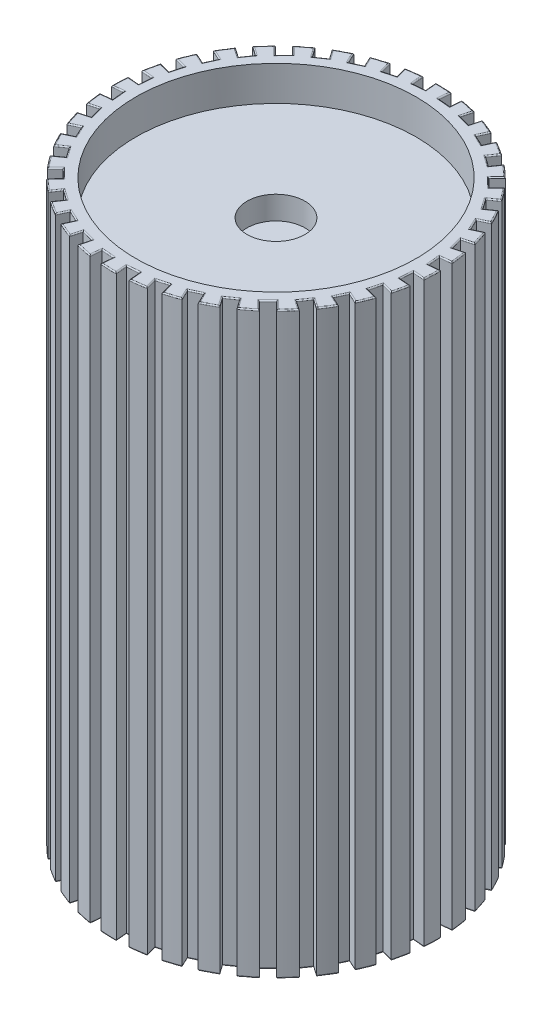
from build123d import *

# Parameters (mm, degrees)
SKETCH_1_R          = 13
EXTRUDE_1_DEPTH     = 50
SKETCH_6_R          = 14
EXTRUDE_4_DEPTH     = 50
SKETCH_2_R          = 12
CUT_EXTRUDE_1_DEPTH = 3
CUT_EXTRUDE_2_DEPTH = 54.777318639
SKETCH_8_R          = 2.5
CUT_EXTRUDE_3_DEPTH = 2
FILLET_6_R          = 0.1
FILLET_7_R          = 0.1
SKETCH_9_R          = 12.1
CUT_EXTRUDE_4_DEPTH = 52.000000147


with BuildPart() as part:
    # 草图1 → 凸台-拉伸1 (new body)
    with BuildSketch(Plane(origin=(0, 0, 0), x_dir=(1, 0, 0), z_dir=(0, 1, 0))):
        with Locations(Location((0, 0, 0), (0, 0, 270))):
            Circle(SKETCH_1_R)
    extrude(amount=EXTRUDE_1_DEPTH)

    # 草图6 → 凸台-拉伸4 (add, through all)
    with BuildSketch(Plane(origin=(0, 50, 0), x_dir=(1, 0, 0), z_dir=(0, 1, 0))):
        with Locations(Location((0, 0, 0), (0, 0, 270))):
            Circle(SKETCH_6_R)
    extrude(amount=-EXTRUDE_4_DEPTH)

    # 草图2 → 切除-拉伸1 (cut)
    with BuildSketch(Plane(origin=(0, 50, 0), x_dir=(1, 0, 0), z_dir=(0, 1, 0))):
        with Locations(Location((0, 0, 0), (0, 0, 270))):
            Circle(SKETCH_2_R)
    extrude(amount=-CUT_EXTRUDE_1_DEPTH, mode=Mode.SUBTRACT)

    # 草图7 → 切除-拉伸2 (cut, through all)
    with BuildSketch(Plane(origin=(0, 50, 0), x_dir=(1, 0, 0), z_dir=(0, 1, 0))):
        Polygon((-15.646830527, 4.142221687), (-12.567085782, 3.326913727), (-12.296421758, 4.349320163), (-15.376166503, 5.164628122), align=None)
        Polygon((-14.689830765, 6.79633564), (-11.798451005, 5.458621977), (-11.354359961, 6.418495447), (-14.245739722, 7.756209109), align=None)
        Polygon((-13.28648793, 9.243946373), (-10.671326264, 7.42447276), (-10.067301683, 8.292647994), (-12.682463348, 10.112121607), align=None)
        Polygon((-11.479441881, 11.410684473), (-9.219958675, 9.164734695), (-8.474353537, 9.914832629), (-10.733836743, 12.160782407), align=None)
        Polygon((-9.3235988, 13.230714699), (-7.488447307, 10.626530804), (-6.623916447, 11.235760092), (-8.45906794, 13.839943987), align=None)
        Polygon((-6.884462888, 14.648736355), (-5.529403257, 11.765445152), (-4.572215008, 12.215294669), (-5.927274639, 15.098585872), align=None)
        Polygon((-4.236146054, 15.621663569), (-3.402351087, 12.546872402), (-2.381589129, 12.8236737), (-3.215384096, 15.898464866), align=None)
        Polygon((-1.459116066, 16.11993444), (-1.171920201, 12.947069284), (-0.11859987, 13.042411894), (-0.405795735, 16.21527705), align=None)
        Polygon((1.362248425, 16.12840926), (1.094118888, 12.953876017), (2.147992986, 12.864863002), (2.416122524, 16.039396246), align=None)
        Polygon((4.142221687, 15.646830527), (3.326913727, 12.567085782), (4.349320163, 12.296421758), (5.164628122, 15.376166503), align=None)
        Polygon((6.79633564, 14.689830765), (5.458621977, 11.798451005), (6.418495447, 11.354359961), (7.756209109, 14.245739722), align=None)
        Polygon((9.243946373, 13.28648793), (7.42447276, 10.671326264), (8.292647994, 10.067301683), (10.112121607, 12.682463348), align=None)
        Polygon((11.410684473, 11.479441881), (9.164734695, 9.219958675), (9.914832629, 8.474353537), (12.160782407, 10.733836743), align=None)
        Polygon((13.230714699, 9.3235988), (10.626530804, 7.488447307), (11.235760092, 6.623916447), (13.839943987, 8.45906794), align=None)
        Polygon((14.648736355, 6.884462888), (11.765445152, 5.529403257), (12.215294669, 4.572215008), (15.098585872, 5.927274639), align=None)
        Polygon((15.621663569, 4.236146054), (12.546872402, 3.402351087), (12.8236737, 2.381589129), (15.898464866, 3.215384096), align=None)
        Polygon((16.11993444, 1.459116066), (12.947069284, 1.171920201), (13.042411894, 0.11859987), (16.21527705, 0.405795735), align=None)
        Polygon((16.12840926, -1.362248425), (12.953876017, -1.094118888), (12.864863002, -2.147992986), (16.039396246, -2.416122524), align=None)
        Polygon((15.646830527, -4.142221687), (12.567085782, -3.326913727), (12.296421758, -4.349320163), (15.376166503, -5.164628122), align=None)
        Polygon((14.689830765, -6.79633564), (11.798451005, -5.458621977), (11.354359961, -6.418495447), (14.245739722, -7.756209109), align=None)
        Polygon((13.28648793, -9.243946373), (10.671326264, -7.42447276), (10.067301683, -8.292647994), (12.682463348, -10.112121607), align=None)
        Polygon((11.479441881, -11.410684473), (9.219958675, -9.164734695), (8.474353537, -9.914832629), (10.733836743, -12.160782407), align=None)
        Polygon((9.3235988, -13.230714699), (7.488447307, -10.626530804), (6.623916447, -11.235760092), (8.45906794, -13.839943987), align=None)
        Polygon((6.884462888, -14.648736355), (5.529403257, -11.765445152), (4.572215008, -12.215294669), (5.927274639, -15.098585872), align=None)
        Polygon((4.236146054, -15.621663569), (3.402351087, -12.546872402), (2.381589129, -12.8236737), (3.215384096, -15.898464866), align=None)
        Polygon((1.459116066, -16.11993444), (1.171920201, -12.947069284), (0.11859987, -13.042411894), (0.405795735, -16.21527705), align=None)
        Polygon((-1.362248425, -16.12840926), (-1.094118888, -12.953876017), (-2.147992986, -12.864863002), (-2.416122524, -16.039396246), align=None)
        Polygon((-4.142221687, -15.646830527), (-3.326913727, -12.567085782), (-4.349320163, -12.296421758), (-5.164628122, -15.376166503), align=None)
        Polygon((-6.79633564, -14.689830765), (-5.458621977, -11.798451005), (-6.418495447, -11.354359961), (-7.756209109, -14.245739722), align=None)
        Polygon((-9.243946373, -13.28648793), (-7.42447276, -10.671326264), (-8.292647994, -10.067301683), (-10.112121607, -12.682463348), align=None)
        Polygon((-11.410684473, -11.479441881), (-9.164734695, -9.219958675), (-9.914832629, -8.474353537), (-12.160782407, -10.733836743), align=None)
        Polygon((-13.230714699, -9.3235988), (-10.626530804, -7.488447307), (-11.235760092, -6.623916447), (-13.839943987, -8.45906794), align=None)
        Polygon((-14.648736355, -6.884462888), (-11.765445152, -5.529403257), (-12.215294669, -4.572215008), (-15.098585872, -5.927274639), align=None)
        Polygon((-15.621663569, -4.236146054), (-12.546872402, -3.402351087), (-12.8236737, -2.381589129), (-15.898464866, -3.215384096), align=None)
        Polygon((-16.11993444, -1.459116066), (-12.947069284, -1.171920201), (-13.042411894, -0.11859987), (-16.21527705, -0.405795735), align=None)
        Polygon((-16.12840926, 1.362248425), (-12.953876017, 1.094118888), (-12.864863002, 2.147992986), (-16.039396246, 2.416122524), align=None)
    extrude(amount=-CUT_EXTRUDE_2_DEPTH, mode=Mode.SUBTRACT)

    # 草图8 → 切除-拉伸3 (cut)
    with BuildSketch(Plane(origin=(0, 47, 0), x_dir=(1, 0, 0), z_dir=(0, 1, 0))):
        with Locations(Location((0, 0, 0), (0, 0, 270))):
            Circle(SKETCH_8_R)
    extrude(amount=-CUT_EXTRUDE_3_DEPTH, mode=Mode.SUBTRACT)

    # 圆角6
    fillet_6_edges = [part.edges().sort_by_distance(p)[0] for p in [
        (-8.620385675, 0, -11.031271496),
        (-10.404982839, 0, -9.366767432),
        (-11.873429865, 0, -7.417658879),
        (-12.981108733, 0, -5.243168514),
        (-13.69436318, 0, -2.909367127),
        (-13.991521333, 0, -0.487166093),
        (-13.863554189, 0, 1.949837237),
        (-13.314349967, 0, 4.327595749),
        (-12.360595958, 0, 6.573862454),
        (-11.031271496, 0, 8.620385675),
        (-9.366767432, 0, 10.404982839),
        (-7.417658879, 0, 11.873429865),
        (-5.243168514, 0, 12.981108733),
        (-2.909367127, 0, 13.69436318),
        (-0.487166093, 0, 13.991521333),
        (2.18839096, 0, -13.343156859),
        (1.621055937, 0, -12.909369509),
        (1.136200383, 0, -13.452102017),
        (-0.161870489, 0, -13.520454427),
        (-0.645260035, 0, -12.994740589),
        (-1.216994055, 0, -13.445033487),
        (-2.507213585, 0, -13.286939828),
        (-2.891970108, 0, -12.685273051),
        (-3.533210744, 0, -13.029444418),
        (-4.776376265, 0, -12.649708287),
        (-5.050809132, 0, -11.990369911),
        (-5.742072613, 0, -12.217962273),
        (-10.461317326, 0, -8.566780594),
        (-10.369313973, 0, -7.858560377),
        (-11.08176189, 0, -7.710029405),
        (-11.789992248, 0, -6.620043258),
        (-11.576405483, 0, -5.938558712),
        (-12.252237582, 0, -5.668568976),
        (-6.900411169, 0, -11.62812176),
        (-7.056181877, 0, -10.931145448),
        (-7.776464511, 0, -11.035243527),
        (-8.814780571, 0, -10.253220637),
        (-8.847156106, 0, -9.539783662),
        (-9.57457247, 0, -9.517224491),
        (13.520454427, 0, -0.161870489),
        (12.994740589, 0, -0.645260035),
        (13.445033487, 0, -1.216994055),
        (13.286939828, 0, -2.507213585),
        (12.685273051, 0, -2.891970108),
        (13.029444418, 0, -3.533210744),
        (11.62812176, 0, -6.900411169),
        (10.931145448, 0, -7.056181877),
        (11.035243527, 0, -7.776464511),
        (12.649708287, 0, -4.776376265),
        (11.990369911, 0, -5.050809132),
        (12.217962273, 0, -5.742072613),
        (4.472159257, 0, -12.760434222),
        (3.838116945, 0, -12.43175377),
        (3.454871948, 0, -13.050435235),
        (6.620043258, 0, -11.789992248),
        (5.938558712, 0, -11.576405483),
        (5.668568976, 0, -12.252237582),
        (10.253220637, 0, -8.814780571),
        (9.539783662, 0, -8.847156106),
        (9.517224491, 0, -9.57457247),
        (8.566780594, 0, -10.461317326),
        (7.858560377, 0, -10.369313973),
        (7.710029405, 0, -11.08176189),
        (6.900411169, 0, 11.62812176),
        (7.056181877, 0, 10.931145448),
        (7.776464511, 0, 11.035243527),
        (8.814780571, 0, 10.253220637),
        (8.847156106, 0, 9.539783662),
        (9.57457247, 0, 9.517224491),
        (4.776376265, 0, 12.649708287),
        (5.050809132, 0, 11.990369911),
        (5.742072613, 0, 12.217962273),
        (2.507213585, 0, 13.286939828),
        (2.891970108, 0, 12.685273051),
        (3.533210744, 0, 13.029444418),
        (11.789992248, 0, 6.620043258),
        (11.576405483, 0, 5.938558712),
        (12.252237582, 0, 5.668568976),
        (10.461317326, 0, 8.566780594),
        (10.369313973, 0, 7.858560377),
        (11.08176189, 0, 7.710029405),
        (12.760434222, 0, 4.472159257),
        (12.43175377, 0, 3.838116945),
        (13.050435235, 0, 3.454871948),
        (13.343156859, 0, 2.18839096),
        (12.909369509, 0, 1.621055937),
        (13.452102017, 0, 1.136200383),
        (-10.253220637, 0, 8.814780571),
        (-9.539783662, 0, 8.847156106),
        (-9.517224491, 0, 9.57457247),
        (-8.566780594, 0, 10.461317326),
        (-7.858560377, 0, 10.369313973),
        (-7.710029405, 0, 11.08176189),
        (-12.649708287, 0, 4.776376265),
        (-11.990369911, 0, 5.050809132),
        (-12.217962273, 0, 5.742072613),
        (-11.62812176, 0, 6.900411169),
        (-10.931145448, 0, 7.056181877),
        (-11.035243527, 0, 7.776464511),
        (-6.620043258, 0, 11.789992248),
        (-5.938558712, 0, 11.576405483),
        (-5.668568976, 0, 12.252237582),
        (-4.472159257, 0, 12.760434222),
        (-3.838116945, 0, 12.43175377),
        (-3.454871948, 0, 13.050435235),
        (-2.18839096, 0, 13.343156859),
        (-1.621055937, 0, 12.909369509),
        (-1.136200383, 0, 13.452102017),
        (0.161870489, 0, 13.520454427),
        (0.645260035, 0, 12.994740589),
        (1.216994055, 0, 13.445033487),
        (-13.286939828, 0, 2.507213585),
        (-12.685273051, 0, 2.891970108),
        (-13.029444418, 0, 3.533210744),
        (-13.520454427, 0, 0.161870489),
        (-12.994740589, 0, 0.645260035),
        (-13.445033487, 0, 1.216994055),
        (-13.343156859, 0, -2.18839096),
        (-12.909369509, 0, -1.621055937),
        (-13.452102017, 0, -1.136200383),
        (-12.760434222, 0, -4.472159257),
        (-12.43175377, 0, -3.838116945),
        (-13.050435235, 0, -3.454871948),
        (1.949837237, 0, 13.863554189),
        (4.327595749, 0, 13.314349967),
        (6.573862454, 0, 12.360595958),
        (8.620385675, 0, 11.031271496),
        (10.404982839, 0, 9.366767432),
        (11.873429865, 0, 7.417658879),
        (12.981108733, 0, 5.243168514),
        (13.69436318, 0, 2.909367127),
        (13.991521333, 0, 0.487166093),
        (13.863554189, 0, -1.949837237),
        (13.314349967, 0, -4.327595749),
        (12.360595958, 0, -6.573862454),
        (11.031271496, 0, -8.620385675),
        (9.366767432, 0, -10.404982839),
        (7.417658879, 0, -11.873429865),
        (5.243168514, 0, -12.981108733),
        (2.909367127, 0, -13.69436318),
        (0.487166093, 0, -13.991521333),
        (-1.949837237, 0, -13.863554189),
        (-4.327595749, 0, -13.314349967),
        (-6.573862454, 0, -12.360595958),
    ]]
    fillet(fillet_6_edges, radius=FILLET_6_R)

    # 圆角7
    fillet_7_edges = [part.edges().sort_by_distance(p)[0] for p in [
        (0, 50, -12),
        (1.949837237, 50, 13.863554189),
        (4.327595749, 50, 13.314349967),
        (6.573862454, 50, 12.360595958),
        (8.620385675, 50, 11.031271496),
        (10.404982839, 50, 9.366767432),
        (11.873429865, 50, 7.417658879),
        (2.18839096, 50, -13.343156859),
        (1.621055937, 50, -12.909369509),
        (12.981108733, 50, 5.243168514),
        (13.69436318, 50, 2.909367127),
        (-0.161870489, 50, -13.520454427),
        (-0.645260035, 50, -12.994740589),
        (13.991521333, 50, 0.487166093),
        (-2.507213585, 50, -13.286939828),
        (13.863554189, 50, -1.949837237),
        (-2.891970108, 50, -12.685273051),
        (13.314349967, 50, -4.327595749),
        (-4.776376265, 50, -12.649708287),
        (-5.050809132, 50, -11.990369911),
        (12.360595958, 50, -6.573862454),
        (11.031271496, 50, -8.620385675),
        (-10.461317326, 50, -8.566780594),
        (-10.369313973, 50, -7.858560377),
        (9.366767432, 50, -10.404982839),
        (-11.789992248, 50, -6.620043258),
        (-11.576405483, 50, -5.938558712),
        (7.417658879, 50, -11.873429865),
        (5.243168514, 50, -12.981108733),
        (-6.900411169, 50, -11.62812176),
        (-7.056181877, 50, -10.931145448),
        (2.909367127, 50, -13.69436318),
        (-8.814780571, 50, -10.253220637),
        (-8.847156106, 50, -9.539783662),
        (0.487166093, 50, -13.991521333),
        (-1.949837237, 50, -13.863554189),
        (13.520454427, 50, -0.161870489),
        (12.994740589, 50, -0.645260035),
        (-4.327595749, 50, -13.314349967),
        (13.286939828, 50, -2.507213585),
        (12.685273051, 50, -2.891970108),
        (-6.573862454, 50, -12.360595958),
        (-8.620385675, 50, -11.031271496),
        (11.62812176, 50, -6.900411169),
        (10.931145448, 50, -7.056181877),
        (-10.404982839, 50, -9.366767432),
        (12.649708287, 50, -4.776376265),
        (-11.873429865, 50, -7.417658879),
        (11.990369911, 50, -5.050809132),
        (-12.981108733, 50, -5.243168514),
        (4.472159257, 50, -12.760434222),
        (3.838116945, 50, -12.43175377),
        (-13.69436318, 50, -2.909367127),
        (-13.991521333, 50, -0.487166093),
        (6.620043258, 50, -11.789992248),
        (5.938558712, 50, -11.576405483),
        (-13.863554189, 50, 1.949837237),
        (10.253220637, 50, -8.814780571),
        (9.539783662, 50, -8.847156106),
        (-13.314349967, 50, 4.327595749),
        (-12.360595958, 50, 6.573862454),
        (8.566780594, 50, -10.461317326),
        (7.858560377, 50, -10.369313973),
        (-11.031271496, 50, 8.620385675),
        (6.900411169, 50, 11.62812176),
        (7.056181877, 50, 10.931145448),
        (-9.366767432, 50, 10.404982839),
        (-7.417658879, 50, 11.873429865),
        (8.814780571, 50, 10.253220637),
        (8.847156106, 50, 9.539783662),
        (-5.243168514, 50, 12.981108733),
        (4.776376265, 50, 12.649708287),
        (5.050809132, 50, 11.990369911),
        (-2.909367127, 50, 13.69436318),
        (-0.487166093, 50, 13.991521333),
        (2.507213585, 50, 13.286939828),
        (2.891970108, 50, 12.685273051),
        (-13.050435235, 50, -3.454871948),
        (11.789992248, 50, 6.620043258),
        (11.576405483, 50, 5.938558712),
        (-13.452102017, 50, -1.136200383),
        (10.461317326, 50, 8.566780594),
        (10.369313973, 50, 7.858560377),
        (12.760434222, 50, 4.472159257),
        (12.43175377, 50, 3.838116945),
        (-13.445033487, 50, 1.216994055),
        (13.343156859, 50, 2.18839096),
        (12.909369509, 50, 1.621055937),
        (-13.029444418, 50, 3.533210744),
        (-10.253220637, 50, 8.814780571),
        (-9.539783662, 50, 8.847156106),
        (-8.566780594, 50, 10.461317326),
        (-7.858560377, 50, 10.369313973),
        (1.216994055, 50, 13.445033487),
        (-12.649708287, 50, 4.776376265),
        (-11.990369911, 50, 5.050809132),
        (-1.136200383, 50, 13.452102017),
        (-11.62812176, 50, 6.900411169),
        (-10.931145448, 50, 7.056181877),
        (-6.620043258, 50, 11.789992248),
        (-5.938558712, 50, 11.576405483),
        (-3.454871948, 50, 13.050435235),
        (-4.472159257, 50, 12.760434222),
        (-3.838116945, 50, 12.43175377),
        (-5.668568976, 50, 12.252237582),
        (-2.18839096, 50, 13.343156859),
        (-1.621055937, 50, 12.909369509),
        (0.161870489, 50, 13.520454427),
        (0.645260035, 50, 12.994740589),
        (-11.035243527, 50, 7.776464511),
        (-13.286939828, 50, 2.507213585),
        (-12.685273051, 50, 2.891970108),
        (-12.217962273, 50, 5.742072613),
        (-13.520454427, 50, 0.161870489),
        (-12.994740589, 50, 0.645260035),
        (-13.343156859, 50, -2.18839096),
        (-12.909369509, 50, -1.621055937),
        (-7.710029405, 50, 11.08176189),
        (-12.760434222, 50, -4.472159257),
        (-12.43175377, 50, -3.838116945),
        (-9.517224491, 50, 9.57457247),
        (13.452102017, 50, 1.136200383),
        (13.050435235, 50, 3.454871948),
        (11.08176189, 50, 7.710029405),
        (12.252237582, 50, 5.668568976),
        (3.533210744, 50, 13.029444418),
        (5.742072613, 50, 12.217962273),
        (9.57457247, 50, 9.517224491),
        (7.776464511, 50, 11.035243527),
        (7.710029405, 50, -11.08176189),
        (9.517224491, 50, -9.57457247),
        (5.668568976, 50, -12.252237582),
        (3.454871948, 50, -13.050435235),
        (12.217962273, 50, -5.742072613),
        (11.035243527, 50, -7.776464511),
        (13.029444418, 50, -3.533210744),
        (13.445033487, 50, -1.216994055),
        (-9.57457247, 50, -9.517224491),
        (-7.776464511, 50, -11.035243527),
        (-12.252237582, 50, -5.668568976),
        (-11.08176189, 50, -7.710029405),
        (-5.742072613, 50, -12.217962273),
        (-3.533210744, 50, -13.029444418),
        (-1.216994055, 50, -13.445033487),
        (1.136200383, 50, -13.452102017),
    ]]
    fillet(fillet_7_edges, radius=FILLET_7_R)

    # 草图9 → 切除-拉伸4 (cut, through all)
    with BuildSketch(Plane(origin=(0, 47, 0), x_dir=(1, 0, 0), z_dir=(0, 1, 0))):
        with Locations(Location((0, 0, 0), (0, 0, 90))):
            Circle(SKETCH_9_R)
    extrude(amount=CUT_EXTRUDE_4_DEPTH, mode=Mode.SUBTRACT)


solid = part.part
